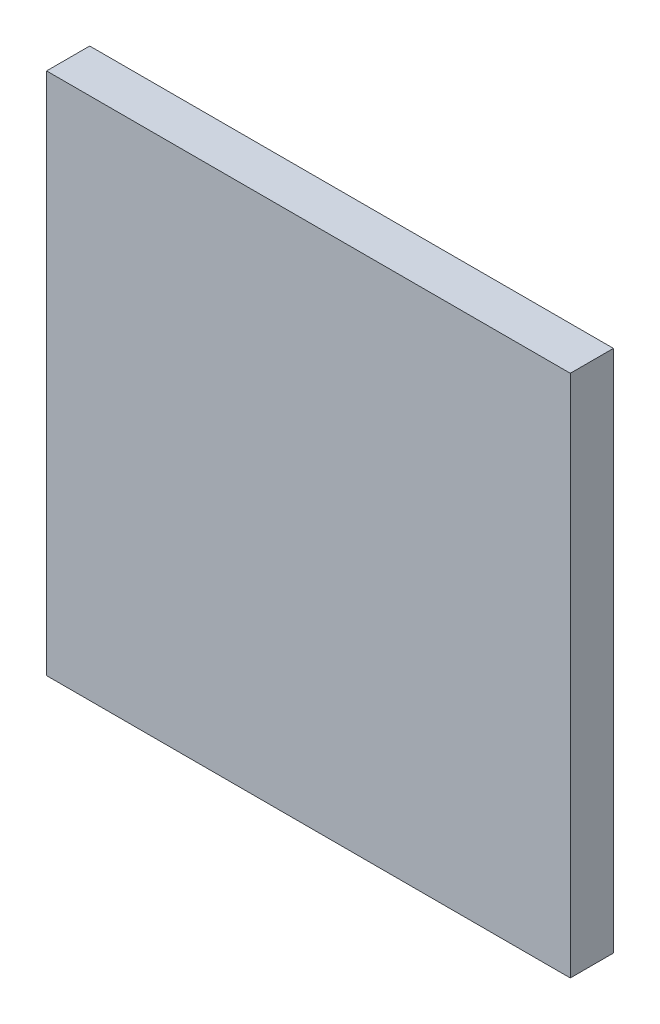
from build123d import *

# Parameters (mm, degrees)
SKETCH_1_W             = 170
SKETCH_1_H             = 170
SM_BASE_FLANGE_1_DEPTH = 14


# Sheet-metal steps are written as plain solids
with BuildPart() as part:
    # Sketch 1 → Базовая кромка1 (new body)
    with BuildSketch(Plane.XY):
        with Locations((85, -85)):
            Rectangle(SKETCH_1_W, SKETCH_1_H)
    extrude(amount=-SM_BASE_FLANGE_1_DEPTH)


solid = part.part
